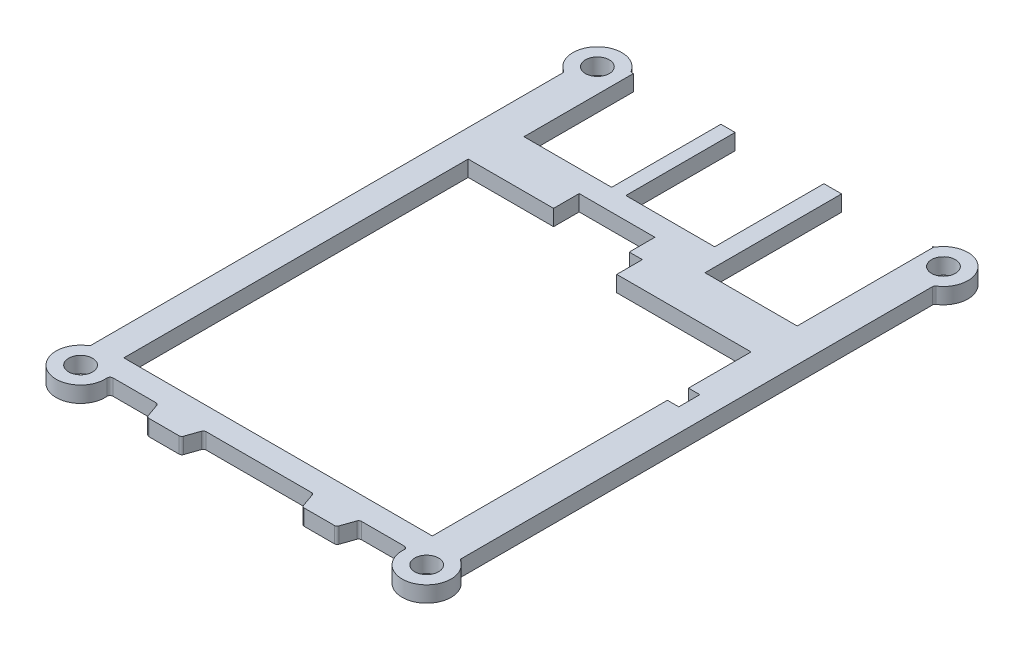
from build123d import *

# Parameters (mm, degrees)
BASEPLATE_OUTLINE_R = 2.1
BASEPLATE_DEPTH     = 2.8
CUT_EXTRUDE1_REACH  = 115.438
SKETCH3_W           = 15.4
SKETCH3_H           = 19.2
SKETCH3_W_2         = 15.6
SKETCH3_W_3         = 16.2
SKETCH3_H_2         = 24


# Read off the part's stored shape, not the designer's step: BasePlate
with BuildPart() as part:
    # BasePlate outline → BasePlate (new body)
    with BuildSketch(Plane(origin=(0, 0, 0), x_dir=(1, 0, 0), z_dir=(0, 1, 0))):
        with BuildLine():
            Line((43.502626614, -5.852332608), (48.792614178, -5.852332608))
            ThreePointArc((48.792614178, -5.852332608), (49.082078508, -5.760021707), (49.264659986, -5.517174213))
            Line((49.264659986, -5.517174213), (50.078201202, -3.187491002))
            ThreePointArc((50.078201202, -3.187491002), (50.26078268, -2.944643509), (50.55024701, -2.852332608))
            Line((50.55024701, -2.852332608), (58.116695703, -2.852332608))
            ThreePointArc((58.116695703, -2.852332608), (58.484685739, -3.013831008), (58.614956567, -3.393999275))
            ThreePointArc((58.614956567, -3.393999275), (64.799237397, -7.61016844), (65.229166667, -0.137781095))
            ThreePointArc((65.229166667, -0.137781095), (65.061014427, 0.043158816), (65, 0.282515593))
            Line((65, 0.282515593), (65, 83.012819192))
            ThreePointArc((65, 83.012819192), (65.061014427, 83.252175969), (65.229166667, 83.433115879))
            ThreePointArc((65.229166667, 83.433115879), (65.940559159, 90.088226551), (59.285448487, 89.376834059))
            ThreePointArc((59.285448487, 89.376834059), (59.104508577, 89.208681819), (58.8651518, 89.147667392))
            Line((58.8651518, 89.147667392), (6.1348482, 89.147667392))
            ThreePointArc((6.1348482, 89.147667392), (5.895491423, 89.208681819), (5.714551513, 89.376834059))
            ThreePointArc((5.714551513, 89.376834059), (-0.940559159, 90.088226551), (-0.229166667, 83.433115879))
            ThreePointArc((-0.229166667, 83.433115879), (-0.061014427, 83.252175969), (0, 83.012819192))
            Line((0, 83.012819192), (0, 0.282515593))
            ThreePointArc((0, 0.282515593), (-0.061014427, 0.043158816), (-0.229166667, -0.137781095))
            ThreePointArc((-0.229166667, -0.137781095), (0.200762603, -7.61016844), (6.385043433, -3.393999275))
            ThreePointArc((6.385043433, -3.393999275), (6.515314261, -3.013831008), (6.883304297, -2.852332608))
            Line((6.883304297, -2.852332608), (14.44975299, -2.852332608))
            ThreePointArc((14.44975299, -2.852332608), (14.73921732, -2.944643509), (14.921798798, -3.187491002))
            Line((14.921798798, -3.187491002), (15.735340014, -5.517174213))
            ThreePointArc((15.735340014, -5.517174213), (15.917921492, -5.760021707), (16.207385822, -5.852332608))
            Line((16.207385822, -5.852332608), (21.497373386, -5.852332608))
            ThreePointArc((21.497373386, -5.852332608), (21.786837716, -5.760021707), (21.969419194, -5.517174213))
            Line((21.969419194, -5.517174213), (22.78296041, -3.187491002))
            ThreePointArc((22.78296041, -3.187491002), (22.965541888, -2.944643509), (23.255006218, -2.852332608))
            Line((23.255006218, -2.852332608), (41.744993782, -2.852332608))
            ThreePointArc((41.744993782, -2.852332608), (42.034458112, -2.944643509), (42.21703959, -3.187491002))
            Line((42.21703959, -3.187491002), (43.030580806, -5.517174213))
            ThreePointArc((43.030580806, -5.517174213), (43.213162284, -5.760021707), (43.502626614, -5.852332608))
        make_face()
        with Locations((2.1, -3.752332608)):
            Circle(BASEPLATE_OUTLINE_R, mode=Mode.SUBTRACT)
        with Locations((62.9, -3.752332608)):
            Circle(BASEPLATE_OUTLINE_R, mode=Mode.SUBTRACT)
        with Locations((2.1, 87.047667392)):
            Circle(BASEPLATE_OUTLINE_R, mode=Mode.SUBTRACT)
        with Locations((62.9, 87.047667392)):
            Circle(BASEPLATE_OUTLINE_R, mode=Mode.SUBTRACT)
    extrude(amount=BASEPLATE_DEPTH)

    # Sketch3 → Cut-Extrude1 (cut, up to next)
    with BuildSketch(Plane(origin=(0, 2.8, 0), x_dir=(1, 0, 0), z_dir=(0, 1, 0)), mode=Mode.PRIVATE) as cut_extrude1_sk1:
        Polygon((4.8, 1.147667392), (59, 1.147667392), (59, 42.447667392), (61, 42.447667392), (61, 46.147667392), (59, 46.147667392), (59, 57.147667392), (35.4, 57.147667392), (35.4, 61.647667392), (33.1, 61.647667392), (33.1, 66.147667392), (19.8, 66.147667392), (19.8, 61.647667392), (4.8, 61.647667392), align=None)
    cut_extrude1_tool1 = extrude(cut_extrude1_sk1.sketch, amount=-CUT_EXTRUDE1_REACH, mode=Mode.PRIVATE) & part.part
    # Sketch3 → Cut-Extrude1 (cut, up to next)
    with BuildSketch(Plane(origin=(0, 2.8, 0), x_dir=(1, 0, 0), z_dir=(0, 1, 0)), mode=Mode.PRIVATE) as cut_extrude1_sk2:
        with Locations((14, 79.547667392)):
            Rectangle(SKETCH3_W, SKETCH3_H)
    cut_extrude1_tool2 = extrude(cut_extrude1_sk2.sketch, amount=-CUT_EXTRUDE1_REACH, mode=Mode.PRIVATE) & part.part
    # Sketch3 → Cut-Extrude1 (cut, up to next)
    with BuildSketch(Plane(origin=(0, 2.8, 0), x_dir=(1, 0, 0), z_dir=(0, 1, 0)), mode=Mode.PRIVATE) as cut_extrude1_sk3:
        with Locations((32, 79.547667392)):
            Rectangle(SKETCH3_W_2, SKETCH3_H)
    cut_extrude1_tool3 = extrude(cut_extrude1_sk3.sketch, amount=-CUT_EXTRUDE1_REACH, mode=Mode.PRIVATE) & part.part
    # Sketch3 → Cut-Extrude1 (cut, up to next)
    with BuildSketch(Plane(origin=(0, 2.8, 0), x_dir=(1, 0, 0), z_dir=(0, 1, 0)), mode=Mode.PRIVATE) as cut_extrude1_sk4:
        with Locations((51, 77.147667392)):
            Rectangle(SKETCH3_W_3, SKETCH3_H_2)
    cut_extrude1_tool4 = extrude(cut_extrude1_sk4.sketch, amount=-CUT_EXTRUDE1_REACH, mode=Mode.PRIVATE) & part.part
    add(cut_extrude1_tool1.solids().sort_by_distance((31.36203, 2.8, -31.109713))[0], mode=Mode.SUBTRACT)
    add(cut_extrude1_tool2.solids().sort_by_distance((14, 2.8, -79.547667))[0], mode=Mode.SUBTRACT)
    add(cut_extrude1_tool3.solids().sort_by_distance((32, 2.8, -79.547667))[0], mode=Mode.SUBTRACT)
    add(cut_extrude1_tool4.solids().sort_by_distance((51, 2.8, -77.147667))[0], mode=Mode.SUBTRACT)


solid = part.part
